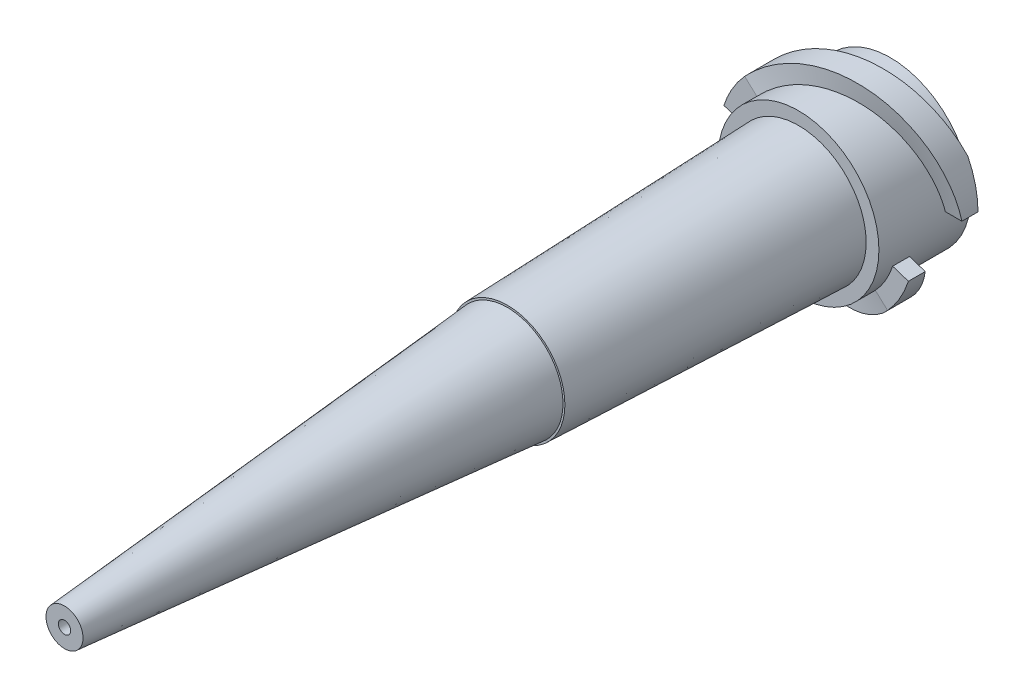
from build123d import *
from build123d.topology import SkipClean

# Parameters (mm, degrees)
SWEEP1_PITCH       = 5
SWEEP1_HEIGHT      = 2.25
SWEEP1_RADIUS      = 3.15
SWEEP1_START_ANGLE = 180
SKETCH3_W          = 0.65
SKETCH3_H          = 1
SKETCH4_W          = 0.868914335
SKETCH4_H          = 0.369387361
SKETCH4_W_2        = 0.738311658
SKETCH4_H_2        = 0.690928268


with BuildPart() as part:
    # Sketch1 → Revolve1 (revolve)
    with BuildSketch(Plane(origin=(0, 0, 0), x_dir=(1, 0, 0), z_dir=(0, 1, 0)), mode=Mode.PRIVATE) as revolve1_sk:
        Polygon((-0.24, 0), (-0.725, 0), (-2.175, 17.35), (-2.25, 17.35), (-2.65, 28.75), (-3.15, 28.75), (-3.15, 32.35), (-2.1, 32.35), (-2.1, 28.75), (-1.655636817, 17.738125355), (-0.862390363, 17.738125355), align=None)
    revolve(revolve1_sk.sketch.rotate(Axis((0, 0, 1.904272973), (0, 0, -1)), 180), axis=Axis((0, 0, 1.904272973), (0, 0, -1)))

    # Sweep1: sweep along a helix
    with BuildLine() as sweep1_path:
        add(Helix(SWEEP1_PITCH, SWEEP1_HEIGHT, SWEEP1_RADIUS, center=(0, 0, -32.35), direction=(0, 0, 1), mode=Mode.PRIVATE).rotate(Axis((0, 0, -32.35), (0, 0, 1)), SWEEP1_START_ANGLE))
    # Sketch3 → Sweep1 (sweep)
    with BuildSketch(Plane(origin=(0, 0, 0), x_dir=(1, 0, 0), z_dir=(0, 1, 0))):
        with Locations((-3.475, 31.85)):
            Rectangle(SKETCH3_W, SKETCH3_H)
        with Locations((3.475, 31.85)):
            Rectangle(SKETCH3_W, SKETCH3_H)
    sweep(path=sweep1_path.line, is_frenet=True)

    # Sketch4 → Cut-Revolve1 (revolve, cut)
    with SkipClean():  # the faces are left unmerged after this step: merging them gives an invalid solid
        with BuildSketch(Plane(origin=(0, 0, 0), x_dir=(1, 0, 0), z_dir=(0, 1, 0))):
            with Locations((-3.584457168, 32.16530632)):
                Rectangle(SKETCH4_W, SKETCH4_H)
            with Locations((-3.519155829, 29.095464134)):
                Rectangle(SKETCH4_W_2, SKETCH4_H_2)
        revolve(axis=Axis((0, 0, -32.799017305), (0, 0, 1)), mode=Mode.SUBTRACT)


solid = part.part
